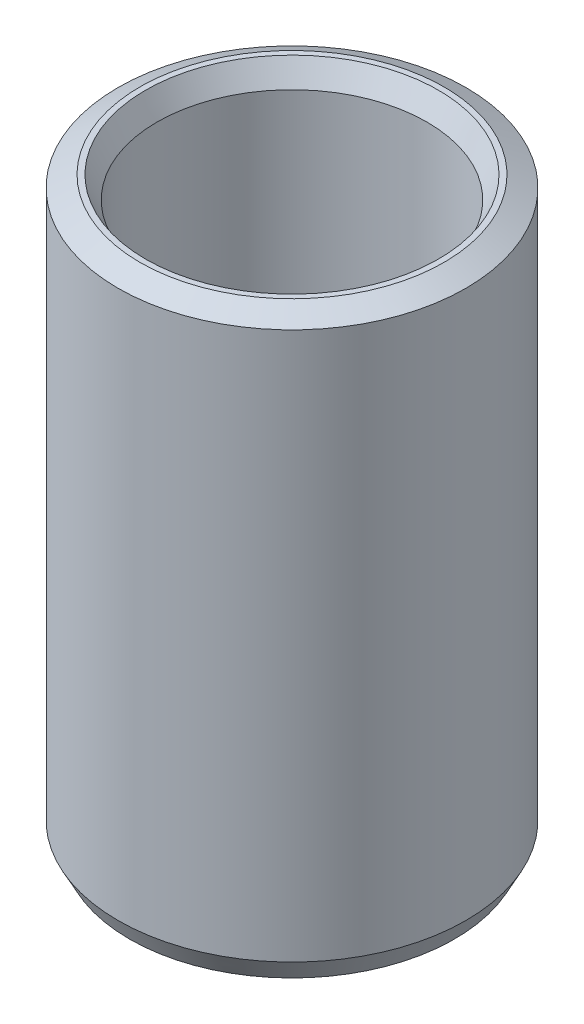
from build123d import *
from OCP.BRepFilletAPI import BRepFilletAPI_MakeChamfer

# Parameters (mm, degrees)
SKETCH1_R           = 12.5
BOSS_EXTRUDE1_DEPTH = 41.750613895
SKETCH2_R           = 9.697963257
CUT_EXTRUDE1_DEPTH  = 46.338876922
CHAMFER1_SIZE       = 0.82438919
CHAMFER1_SIZE2      = 1.572248413


with BuildPart() as part:
    # Sketch1 → Boss-Extrude1 (new body)
    with BuildSketch(Plane(origin=(0, 0, 0), x_dir=(1, 0, 0), z_dir=(0, 1, 0))):
        Circle(SKETCH1_R)
    extrude(amount=BOSS_EXTRUDE1_DEPTH)

    # Sketch2 → Cut-Extrude1 (cut, through all)
    with BuildSketch(Plane(origin=(0, 0, 0), x_dir=(1, 0, 0), z_dir=(0, 1, 0))):
        Circle(SKETCH2_R)
    extrude(amount=CUT_EXTRUDE1_DEPTH, mode=Mode.SUBTRACT)

    # Chamfer1: one chamfer whose edges measure the first distance from different faces: ONE call of the kernel's chamfer builder (chamfer() names one face for all edges)
    chamfer1_edges_1 = [part.edges().sort_by_distance(p)[0] for p in [
        (-9.697963257, 41.750613895, 0),
    ]]
    chamfer1_side_1 = [part.faces().sort_by_distance(p)[0] for p in [
        (-12.146446609, 41.750613895, 0),
    ]]
    chamfer1_edges_2 = [part.edges().sort_by_distance(p)[0] for p in [
        (-9.697963257, 0, 0),
    ]]
    chamfer1_side_2 = [part.faces().sort_by_distance(p)[0] for p in [
        (-9.697963257, 20.875306947, 0),
    ]]
    chamfer1_edges_3 = [part.edges().sort_by_distance(p)[0] for p in [
        (-12.5, 0, 0),
    ]]
    chamfer1_side_3 = [part.faces().sort_by_distance(p)[0] for p in [
        (-12.146446609, 0, 0),
    ]]
    chamfer1_edges_4 = [part.edges().sort_by_distance(p)[0] for p in [
        (-12.5, 41.750613895, 0),
    ]]
    chamfer1_side_4 = [part.faces().sort_by_distance(p)[0] for p in [
        (-12.5, 20.875306947, 0),
    ]]
    chamfer1 = BRepFilletAPI_MakeChamfer(part.part.solid().wrapped)
    for e in chamfer1_edges_1:
        chamfer1.Add(CHAMFER1_SIZE, CHAMFER1_SIZE2, e.wrapped, chamfer1_side_1[0].wrapped)  # the first distance lies on this face
    for e in chamfer1_edges_2:
        chamfer1.Add(CHAMFER1_SIZE, CHAMFER1_SIZE2, e.wrapped, chamfer1_side_2[0].wrapped)  # the first distance lies on this face
    for e in chamfer1_edges_3:
        chamfer1.Add(CHAMFER1_SIZE, CHAMFER1_SIZE2, e.wrapped, chamfer1_side_3[0].wrapped)  # the first distance lies on this face
    for e in chamfer1_edges_4:
        chamfer1.Add(CHAMFER1_SIZE, CHAMFER1_SIZE2, e.wrapped, chamfer1_side_4[0].wrapped)  # the first distance lies on this face
    add(Compound.cast(chamfer1.Shape()), mode=Mode.REPLACE)


solid = part.part
